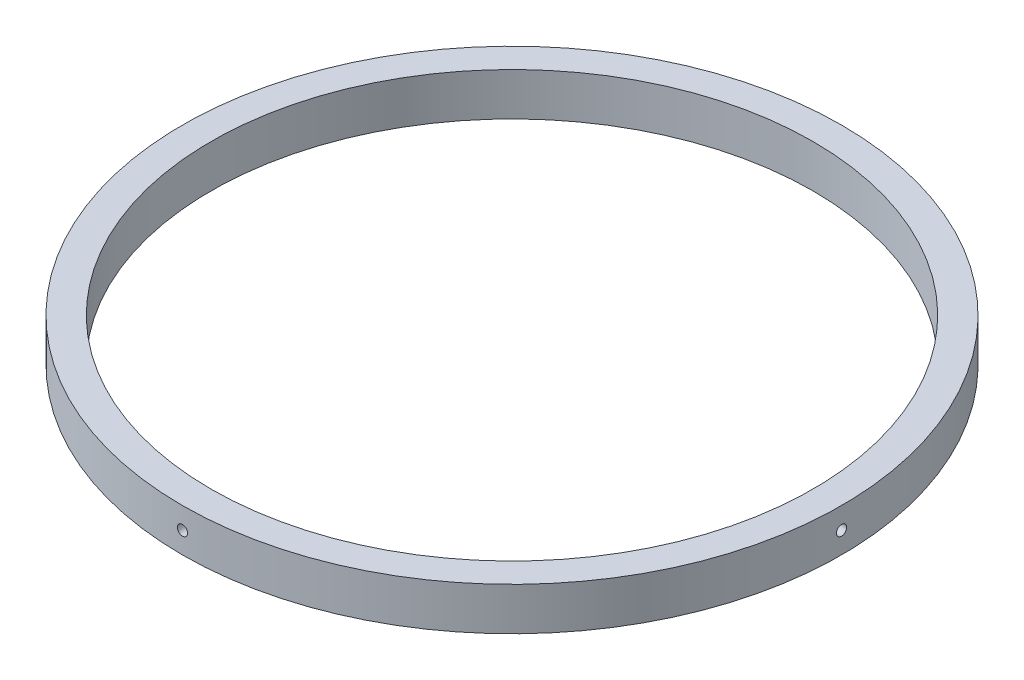
from build123d import *

# Parameters (mm, degrees)
SKETCH1_R           = 73.3171
SKETCH1_R_2         = 66.9671
BOSS_EXTRUDE1_DEPTH = 9.525
CIRPATTERN1_COUNT   = 4


with BuildPart() as part:
    # Sketch1 → Boss-Extrude1 (new body)
    with BuildSketch(Plane(origin=(0, 0, 0), x_dir=(1, 0, 0), z_dir=(0, 1, 0))):
        Circle(SKETCH1_R)
        Circle(SKETCH1_R_2, mode=Mode.SUBTRACT)
    extrude(amount=BOSS_EXTRUDE1_DEPTH)

    # Sketch3 → Tap Drill for #4-40 Tap1 (revolve, cut)
    with BuildSketch(Plane(origin=(0, 4.7625, 73.3171), x_dir=(0, -1, 0), z_dir=(1, 0, 0))):
        Polygon((0, 0), (0, 5.441652758), (1.1303, 4.7625), (1.1303, 0), align=None)
    tap_drill_for_4_40_tap1 = revolve(axis=Axis((0, 4.7625, 79.6671), (0, 0, -1)), mode=Mode.SUBTRACT)

    # CirPattern1: Tap Drill for #4-40 Tap1 ×4 about axis
    cirpattern1_axis = Axis((0, 9.525, 0), (0, 1, 0))
    for i in range(1, CIRPATTERN1_COUNT):
        add(tap_drill_for_4_40_tap1.rotate(cirpattern1_axis, i * 360 / CIRPATTERN1_COUNT), mode=Mode.SUBTRACT)


solid = part.part
